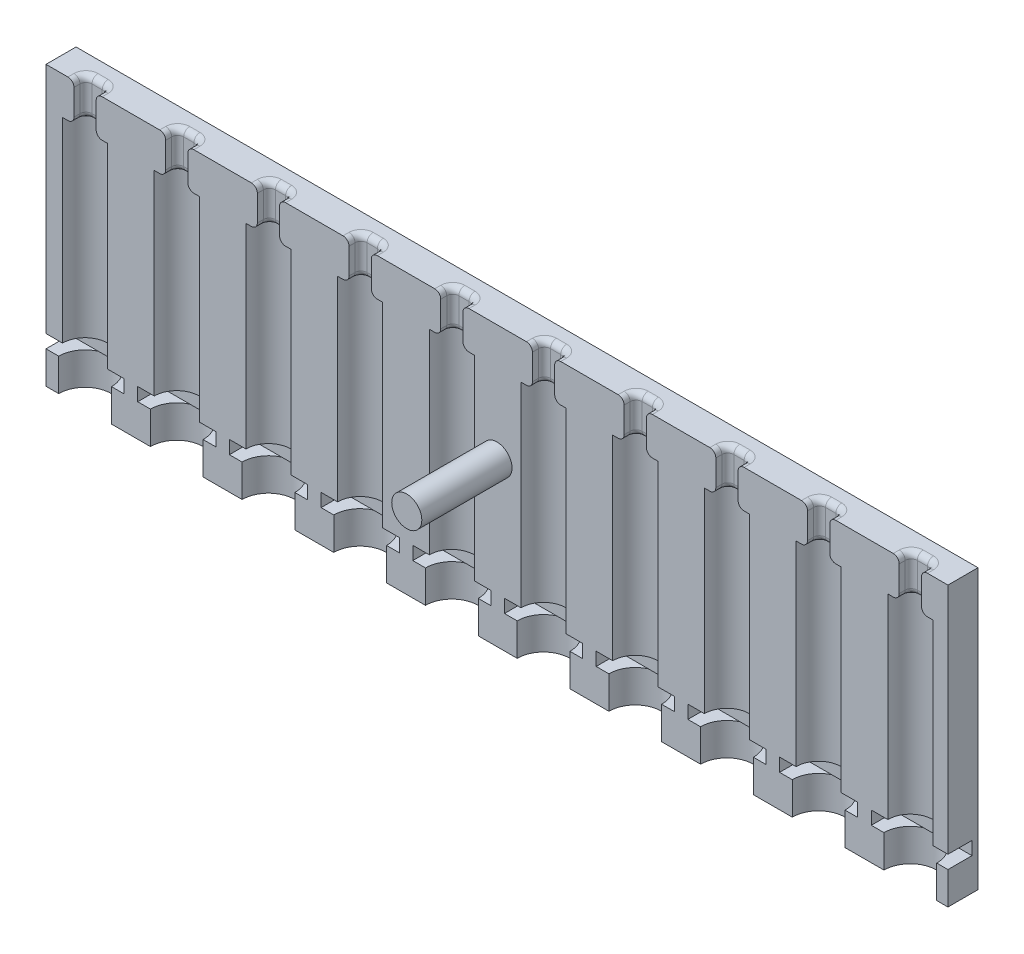
from build123d import *

# Parameters (mm, degrees)
SKETCH1_W              = 150
SKETCH1_H              = 300
BOSS_EXTRUDE1_DEPTH    = 10
FLANGE_SLIT_W          = 26
FLANGE_SLIT_H          = 4.4
FLANGE_SLOT_DEPTH      = 8
SKETCH3_W              = 7.5
SKETCH3_H              = 65
SKETCH6_W              = 57.250839866
SKETCH6_H              = 300
CUT_EXTRUDE2_DEPTH     = 169.002976164
SKETCH7_W              = 8.778199967
SKETCH7_H              = 10.8
SKETCH8_W              = 7.4
SKETCH8_H              = 25.098320268
NEEDLE_SLOT_DEPTH      = 4
FILLET1_R              = 2
LPATTERN3_COUNT        = 10
LPATTERN3_PITCH        = 30.5
FILLET1_OF_LPATTERN3_R = 2
SKETCH9_R              = 5
BOSS_EXTRUDE3_DEPTH    = 30


with BuildPart() as part:
    # Sketch1 → Boss-Extrude1 (new body)
    with BuildSketch(Plane(origin=(0, 0, 0), x_dir=(0, 1, 0), z_dir=(0, 0, 1))):
        Rectangle(SKETCH1_W, SKETCH1_H)
    extrude(amount=BOSS_EXTRUDE1_DEPTH)

    # flange slit → Flange Slot (cut)
    with BuildSketch(Plane.XY.offset(10)):
        with Locations((-137, -62)):
            Rectangle(FLANGE_SLIT_W, FLANGE_SLIT_H)
    flange_slot = extrude(amount=-FLANGE_SLOT_DEPTH, mode=Mode.SUBTRACT)

    # Sketch3 → Syringe Body Slot (revolve, cut)
    with BuildSketch(Plane.XY.offset(10)):
        with Locations((-140.75, -27.3)):
            Rectangle(SKETCH3_W, SKETCH3_H)
    syringe_body_slot = revolve(axis=Axis((-137, 75, 10), (0, -1, 0)), mode=Mode.SUBTRACT)

    # Sketch6 → Cut-Extrude2 (cut, through all)
    with BuildSketch(Plane(origin=(0, 0, 10), x_dir=(0, -1, 0), z_dir=(0, 0, 1))):
        with Locations((-46.374580067, 0)):
            Rectangle(SKETCH6_W, SKETCH6_H)
    extrude(amount=-CUT_EXTRUDE2_DEPTH, mode=Mode.SUBTRACT)

    # Sketch7 → Plunger Slot (revolve, cut)
    with BuildSketch(Plane.XY.offset(10)):
        with Locations((-141.389099983, -69.6)):
            Rectangle(SKETCH7_W, SKETCH7_H)
    plunger_slot = revolve(axis=Axis((-137, -64.2, 10), (0, -1, 0)), mode=Mode.SUBTRACT)

    # Sketch8 → Needle Slot (cut)
    with BuildSketch(Plane.XY.offset(10)):
        with Locations((-137, 5.2)):
            Rectangle(SKETCH8_W, SKETCH8_H)
    needle_slot = extrude(amount=-NEEDLE_SLOT_DEPTH, mode=Mode.SUBTRACT)

    # Fillet1
    fillet1_edges = [part.edges().sort_by_distance(p)[0] for p in [
        (-140.7, 17.749160134, 8),
        (-140.7, 5.2, 8),
        (-133.3, 17.749160134, 8),
        (-133.3, 5.2, 8),
        (-140.7, 11.474580067, 6),
        (-137, 17.749160134, 6),
        (-133.3, 11.474580067, 6),
        (-137, 5.2, 6),
    ]]
    fillet(fillet1_edges, radius=FILLET1_R)

    # LPattern3: Flange Slot, Syringe Body Slot, Plunger Slot, Needle Slot ×10
    with Locations(*[(i * LPATTERN3_PITCH, 0, 0) for i in range(1, LPATTERN3_COUNT)]):
        add(flange_slot, mode=Mode.SUBTRACT)
        add(syringe_body_slot, mode=Mode.SUBTRACT)
        add(plunger_slot, mode=Mode.SUBTRACT)
        add(needle_slot, mode=Mode.SUBTRACT)

    # Fillet1 of LPattern3
    fillet1_of_lpattern3_edges = [part.edges().sort_by_distance(p)[0] for p in [
        (-110.2, 17.749160134, 8),
        (-110.2, 5.2, 8),
        (-102.8, 17.749160134, 8),
        (-102.8, 5.2, 8),
        (-110.2, 11.474580067, 6),
        (-106.5, 17.749160134, 6),
        (-102.8, 11.474580067, 6),
        (-106.5, 5.2, 6),
        (-79.7, 17.749160134, 8),
        (-79.7, 5.2, 8),
        (-72.3, 17.749160134, 8),
        (-72.3, 5.2, 8),
        (-79.7, 11.474580067, 6),
        (-76, 17.749160134, 6),
        (-72.3, 11.474580067, 6),
        (-76, 5.2, 6),
        (-49.2, 17.749160134, 8),
        (-49.2, 5.2, 8),
        (-41.8, 17.749160134, 8),
        (-41.8, 5.2, 8),
        (-49.2, 11.474580067, 6),
        (-45.5, 17.749160134, 6),
        (-41.8, 11.474580067, 6),
        (-45.5, 5.2, 6),
        (-18.7, 17.749160134, 8),
        (-18.7, 5.2, 8),
        (-11.3, 17.749160134, 8),
        (-11.3, 5.2, 8),
        (-18.7, 11.474580067, 6),
        (-15, 17.749160134, 6),
        (-11.3, 11.474580067, 6),
        (-15, 5.2, 6),
        (11.8, 17.749160134, 8),
        (11.8, 5.2, 8),
        (19.2, 17.749160134, 8),
        (19.2, 5.2, 8),
        (11.8, 11.474580067, 6),
        (15.5, 17.749160134, 6),
        (19.2, 11.474580067, 6),
        (15.5, 5.2, 6),
        (42.3, 17.749160134, 8),
        (42.3, 5.2, 8),
        (49.7, 17.749160134, 8),
        (49.7, 5.2, 8),
        (42.3, 11.474580067, 6),
        (46, 17.749160134, 6),
        (49.7, 11.474580067, 6),
        (46, 5.2, 6),
        (72.8, 17.749160134, 8),
        (72.8, 5.2, 8),
        (80.2, 17.749160134, 8),
        (80.2, 5.2, 8),
        (72.8, 11.474580067, 6),
        (76.5, 17.749160134, 6),
        (80.2, 11.474580067, 6),
        (76.5, 5.2, 6),
        (103.3, 17.749160134, 8),
        (103.3, 5.2, 8),
        (110.7, 17.749160134, 8),
        (110.7, 5.2, 8),
        (103.3, 11.474580067, 6),
        (107, 17.749160134, 6),
        (110.7, 11.474580067, 6),
        (107, 5.2, 6),
        (133.8, 17.749160134, 8),
        (133.8, 5.2, 8),
        (141.2, 17.749160134, 8),
        (141.2, 5.2, 8),
        (133.8, 11.474580067, 6),
        (137.5, 17.749160134, 6),
        (141.2, 11.474580067, 6),
        (137.5, 5.2, 6),
    ]]
    fillet(fillet1_of_lpattern3_edges, radius=FILLET1_OF_LPATTERN3_R)

    # Sketch9 → Boss-Extrude3 (add)
    with BuildSketch(Plane.XY.offset(10)):
        with Locations((0, -21.025419933)):
            Circle(SKETCH9_R)
    extrude(amount=BOSS_EXTRUDE3_DEPTH)


solid = part.part
